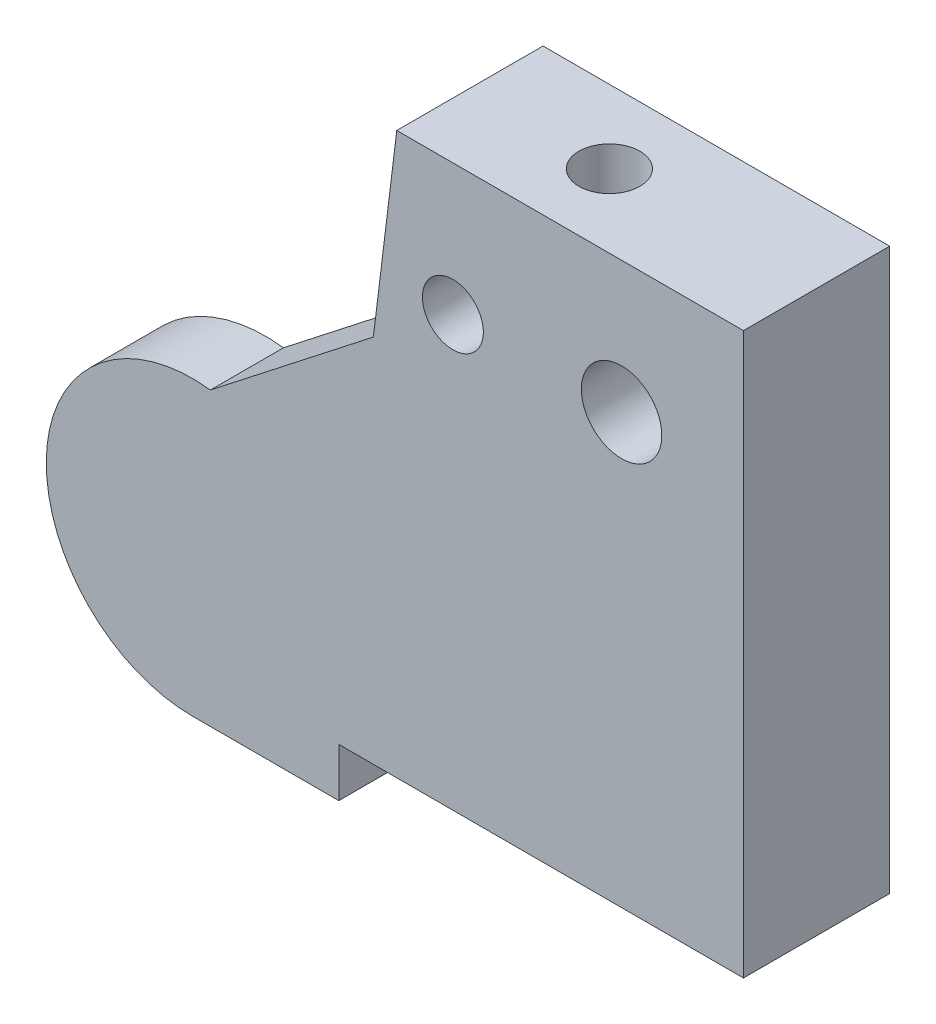
from build123d import *

# Parameters (mm, degrees)
RESSALTO_EXTRUS_O1_DEPTH      = 3
ESBO_O1_3_W                   = 16.6
ESBO_O1_3_H                   = 23
ESBO_O1_3_R                   = 1.5
ESBO_O1_3_R_2                 = 0.5
RESSALTO_EXTRUS_O2_DEPTH      = 6
CORTE_EXTRUS_O1_DEPTH         = 3
CORTE_EXTRUS_O2_DEPTH         = 3
CHANFRO1_SIZE                 = 6
FURO_ROSCADO_DE_M3X0_51_D     = 2.5
FURO_ROSCADO_DE_M3X0_51_DEPTH = 8.5
FURO_ROSCADO_DE_M3X0_51_TIP   = 0.751075774
FURO_ROSCADO_DE_M3X0_52_D     = 2.5
FURO_ROSCADO_DE_M3X0_53_D     = 2.5
FURO_ROSCADO_DE_M3X0_53_DEPTH = 3
FURO_ROSCADO_DE_M3X0_53_TIP   = 0.751075774
ESBO_O17_R                    = 2.45
RESSALTO_EXTRUS_O3_DEPTH      = 3.5
CHANFRO2_SIZE                 = 0.5
FURO_ROSCADO_DE_M4X0_73_D     = 3.3
FURO_ROSCADO_DE_M4X0_73_DEPTH = 11.5
FURO_ROSCADO_DE_M4X0_73_TIP   = 0.991420021


with BuildPart() as part:
    # Esboço1 → Ressalto-extrusão1 (new body)
    with BuildSketch(Plane.XY):
        with BuildLine():
            Line((0, -2), (0, 0))
            Line((0, 0), (0, 16))
            ThreePointArc((0, 16), (-1.757359313, 11.757359313), (-6, 10))
            ThreePointArc((-6, 10), (-12, 4), (-6, -2))
            Line((-6, -2), (0, -2))
        make_face()
    extrude(amount=RESSALTO_EXTRUS_O1_DEPTH)

    # Esboço1<3> → Ressalto-extrusão2 (add)
    with BuildSketch(Plane.XY):
        with Locations((8.3, 11.5)):
            Rectangle(ESBO_O1_3_W, ESBO_O1_3_H)
        with Locations((11.6, 17.6)):
            Circle(ESBO_O1_3_R, mode=Mode.SUBTRACT)
        with Locations((4.68, 17.61)):
            Circle(ESBO_O1_3_R_2, mode=Mode.SUBTRACT)
    extrude(amount=RESSALTO_EXTRUS_O2_DEPTH)


with BuildPart() as body_2:
    # Espelhar1: mirrored copy
    add(part.part.mirror(Plane.XY.offset(6)))

    # Esboço4 → Corte-extrusão1 (cut)
    with BuildSketch(Plane(origin=(0, 0, 6), x_dir=(-1, 0, 0), z_dir=(0, 0, -1))):
        Polygon((0, 3.633024279), (-2.37796561, 23), (0, 23), align=None)
    extrude(amount=-CORTE_EXTRUS_O1_DEPTH, mode=Mode.SUBTRACT)

    # Esboço5 → Corte-extrusão2 (cut)
    with BuildSketch(Plane(origin=(0, 0, 9), x_dir=(-1, 0, 0), z_dir=(0, 0, -1))):
        with BuildLine():
            Line((-0.68649297, 9.224060849), (5.26878394, 9.95527691))
            ThreePointArc((5.26878394, 9.95527691), (5.633708763, 9.988808791), (6, 10))
            ThreePointArc((6, 10), (1.757359313, 11.757359313), (0, 16))
            Line((0, 16), (0, 23))
            Line((0, 23), (-2.37796561, 23))
            Line((-2.37796561, 23), (-0.68649297, 9.224060849))
        make_face()
    extrude(amount=-CORTE_EXTRUS_O2_DEPTH, mode=Mode.SUBTRACT)

    # Chanfro1
    # the kernel refuses this chamfer: 6 mm, written as the material it adds along each edge
    with BuildSketch(Plane(origin=(0.68649297, 9.224060849, 9), x_dir=(-0.9955217911555101, 0.09453234015153285, 0), z_dir=(0, 0, 1))) as chanfro1_piece_1:
        Polygon((CHANFRO1_SIZE * 0.999621916911, -CHANFRO1_SIZE * 0.0274958766106), (-CHANFRO1_SIZE * 0.0274958766106, -CHANFRO1_SIZE * 0.999621916911), (0, 0), align=None)
    extrude(amount=3)

    # Furo roscado de M3x0.51
    with Locations(Plane.XZ):
        with Locations((4, 9), (12.6, 9)):
            Hole(FURO_ROSCADO_DE_M3X0_51_D / 2, depth=FURO_ROSCADO_DE_M3X0_51_DEPTH)
            with Locations((0, 0, -(FURO_ROSCADO_DE_M3X0_51_DEPTH + FURO_ROSCADO_DE_M3X0_51_TIP / 2))):  # 118° drill point
                Cone(0, FURO_ROSCADO_DE_M3X0_51_D / 2, FURO_ROSCADO_DE_M3X0_51_TIP, mode=Mode.SUBTRACT)

    # Furo roscado de M3x0.52 (through all)
    with Locations(Plane(origin=(0, 0, 6), x_dir=(-1, 0, 0), z_dir=(0, 0, -1))):
        with Locations((-4.68, 17.61)):
            Hole(FURO_ROSCADO_DE_M3X0_52_D / 2)

    # Furo roscado de M3x0.53
    with Locations(Plane(origin=(0, 23, 0), x_dir=(-1, 0, 0), z_dir=(0, 1, 0))):
        with Locations((-8.1, 9)):
            Hole(FURO_ROSCADO_DE_M3X0_53_D / 2, depth=FURO_ROSCADO_DE_M3X0_53_DEPTH)
            with Locations((0, 0, -(FURO_ROSCADO_DE_M3X0_53_DEPTH + FURO_ROSCADO_DE_M3X0_53_TIP / 2))):  # 118° drill point
                Cone(0, FURO_ROSCADO_DE_M3X0_53_D / 2, FURO_ROSCADO_DE_M3X0_53_TIP, mode=Mode.SUBTRACT)

    # Esboço17 → Ressalto-extrusão3 (add)
    with BuildSketch(Plane(origin=(0, 0, 9), x_dir=(-1, 0, 0), z_dir=(0, 0, -1))):
        with Locations((6, 4)):
            Circle(ESBO_O17_R)
    extrude(amount=RESSALTO_EXTRUS_O3_DEPTH)

    # Chanfro2
    chanfro2_edges = [body_2.edges().sort_by_distance(p)[0] for p in [
        (-3.55, 4, 5.5),
    ]]
    chamfer(chanfro2_edges, length=CHANFRO2_SIZE)

    # Furo roscado de M4x0.73
    with Locations(Plane(origin=(0, 0, 6), x_dir=(-1, 0, 0), z_dir=(0, 0, -1))):
        with Locations((-11.6, 17.6)):
            Hole(FURO_ROSCADO_DE_M4X0_73_D / 2, depth=FURO_ROSCADO_DE_M4X0_73_DEPTH)
            with Locations((0, 0, -(FURO_ROSCADO_DE_M4X0_73_DEPTH + FURO_ROSCADO_DE_M4X0_73_TIP / 2))):  # 118° drill point
                Cone(0, FURO_ROSCADO_DE_M4X0_73_D / 2, FURO_ROSCADO_DE_M4X0_73_TIP, mode=Mode.SUBTRACT)


solid = body_2.part
